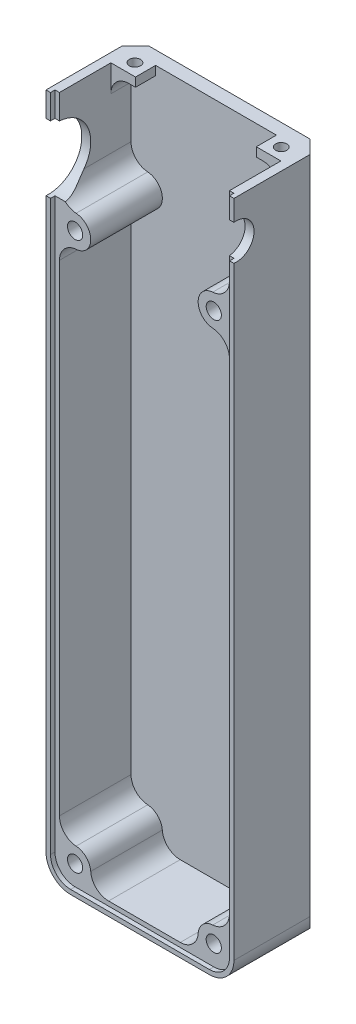
from build123d import *

# Parameters (mm, degrees)
SKETCH_1_W                  = 42
SKETCH_1_H                  = 153
EXTRUDE_1_DEPTH             = 20
SKETCH_2_W                  = 38
SKETCH_2_H                  = 149
CUT_EXTRUDE_1_DEPTH         = 17
EXTRUDE_3_DEPTH             = 17
FILLET_START                = 2
FILLET_2_DEPTH              = 18
CHAMFER_1_SIZE              = 3
CUT_EXTRUDE_3_DEPTH         = 82.812285141
SKETCH_8_R                  = 4
CUT_EXTRUDE_4_DEPTH         = 90.533513279
SKETCH_13_W                 = 27
SKETCH_13_H                 = 7.55790464
CUT_EXTRUDE_6_DEPTH         = 17
SKETCH_14_W                 = 38
SKETCH_14_H                 = 15.071373518
CUT_EXTRUDE_7_DEPTH         = 12.5
CUT_EXTRUDE_8_DEPTH         = 1
HOLE_WIZARD_M31_D           = 3.4
HOLE_WIZARD_M31_CBORE_D     = 6.5
HOLE_WIZARD_M31_CBORE_DEPTH = 3
M3X0_51_D                   = 2.5
M3X0_51_DEPTH               = 12.5
M3X0_51_TIP                 = 0.751075774
CUT_EXTRUDE_9_REACH         = 91.534
SKETCH_22_R                 = 7.5
CUT_EXTRUDE_10_REACH        = 91.534
SKETCH_23_R                 = 4


with BuildPart() as part:
    # Эскиз1 → Бобышка-Вытянуть1 (new body)
    with BuildSketch(Plane.XY):
        Rectangle(SKETCH_1_W, SKETCH_1_H)
    extrude(amount=EXTRUDE_1_DEPTH)

    # Эскиз2 → Вырез-Вытянуть1 (cut)
    with BuildSketch(Plane.XY.offset(20)):
        Rectangle(SKETCH_2_W, SKETCH_2_H)
    extrude(amount=-CUT_EXTRUDE_1_DEPTH, mode=Mode.SUBTRACT)

    # Эскиз3 → Бобышка-Вытянуть3 (add)
    with BuildSketch(Plane.XY.offset(20)):
        with BuildLine():
            Line((-19, -71), (-19, -74.5))
            Line((-19, -74.5), (-15.5, -74.5))
            ThreePointArc((-15.5, -74.5), (-13.025126266, -68.525126266), (-19, -71))
        make_face()
        with BuildLine():
            Line((19, -71), (19, -74.5))
            Line((19, -74.5), (15.5, -74.5))
            ThreePointArc((15.5, -74.5), (13.025126266, -68.525126266), (19, -71))
        make_face()
        with BuildLine():
            Line((-15.5, 55), (-19, 55))
            Line((-19, 55), (-19, 48))
            Line((-19, 48), (-15.5, 48))
            ThreePointArc((-15.5, 48), (-12, 51.5), (-15.5, 55))
        make_face()
        with BuildLine():
            Line((15.5, 55), (19, 55))
            Line((19, 55), (19, 48))
            Line((19, 48), (15.5, 48))
            ThreePointArc((15.5, 48), (12, 51.5), (15.5, 55))
        make_face()
    extrude(amount=-EXTRUDE_3_DEPTH)

    # Скругление2: read off the stored shape, not the designer's step
    # Скругление2 outline → Скругление2 (add)
    with BuildSketch(Plane.XY.offset(FILLET_START)):
        with BuildLine():
            ThreePointArc((19, 58.983314774), (17.921186974, 56.25079457), (15.266666667, 54.992213561))
            ThreePointArc((15.266666667, 54.992213561), (15.383268392, 54.998052849), (15.5, 55))
            Line((15.5, 55), (19, 55))
            Line((19, 55), (19, 58.983314774))
        make_face()
        with BuildLine():
            ThreePointArc((15.5, 48), (15.383268392, 48.001947151), (15.266666667, 48.007786439))
            ThreePointArc((15.266666667, 48.007786439), (17.921186974, 46.74920543), (19, 44.016685226))
            Line((19, 44.016685226), (19, 48))
            Line((19, 48), (15.5, 48))
        make_face()
        with BuildLine():
            ThreePointArc((15, 74.5), (17.828427125, 73.328427125), (19, 70.5))
            Line((19, 70.5), (19, 74.5))
            Line((19, 74.5), (15, 74.5))
        make_face()
        with BuildLine():
            Line((19, -71), (19, -63.516685226))
            ThreePointArc((19, -63.516685226), (17.921186974, -66.24920543), (15.266666667, -67.507786439))
            ThreePointArc((15.266666667, -67.507786439), (17.890955179, -68.443961399), (19, -71))
        make_face()
        with BuildLine():
            ThreePointArc((-19, 70.5), (-17.828427125, 73.328427125), (-15, 74.5))
            Line((-15, 74.5), (-19, 74.5))
            Line((-19, 74.5), (-19, 70.5))
        make_face()
        with BuildLine():
            ThreePointArc((15.5, -74.5), (12.943961399, -73.390955179), (12.007786439, -70.766666667))
            ThreePointArc((12.007786439, -70.766666667), (10.74920543, -73.421186974), (8.016685226, -74.5))
            Line((8.016685226, -74.5), (15.5, -74.5))
        make_face()
        with BuildLine():
            ThreePointArc((-15.266666667, 54.992213561), (-17.921186974, 56.25079457), (-19, 58.983314774))
            Line((-19, 58.983314774), (-19, 55))
            Line((-19, 55), (-15.5, 55))
            ThreePointArc((-15.5, 55), (-15.383268392, 54.998052849), (-15.266666667, 54.992213561))
        make_face()
        with BuildLine():
            Line((-15.5, -74.5), (-8.016685226, -74.5))
            ThreePointArc((-8.016685226, -74.5), (-10.74920543, -73.421186974), (-12.007786439, -70.766666667))
            ThreePointArc((-12.007786439, -70.766666667), (-12.943961399, -73.390955179), (-15.5, -74.5))
        make_face()
        with BuildLine():
            ThreePointArc((-19, 44.016685226), (-17.921186974, 46.74920543), (-15.266666667, 48.007786439))
            ThreePointArc((-15.266666667, 48.007786439), (-15.383268392, 48.001947151), (-15.5, 48))
            Line((-15.5, 48), (-19, 48))
            Line((-19, 48), (-19, 44.016685226))
        make_face()
        with BuildLine():
            ThreePointArc((-19, -71), (-17.890955179, -68.443961399), (-15.266666667, -67.507786439))
            ThreePointArc((-15.266666667, -67.507786439), (-17.921186974, -66.24920543), (-19, -63.516685226))
            Line((-19, -63.516685226), (-19, -71))
        make_face()
    extrude(amount=FILLET_2_DEPTH)

    # Фаска1
    chamfer_1_edges = [part.edges().sort_by_distance(p)[0] for p in [
        (-21, 0, 0),
        (21, 0, 0),
    ]]
    chamfer(chamfer_1_edges, length=CHAMFER_1_SIZE)

    # Эскиз7 → Вырез-Вытянуть3 (cut, through all)
    with BuildSketch(Plane.XY.offset(20)):
        with BuildLine():
            Line((-21, -71), (-21, -76.5))
            Line((-21, -76.5), (-15.5, -76.5))
            ThreePointArc((-15.5, -76.5), (-19.389087297, -74.889087297), (-21, -71))
        make_face()
        with BuildLine():
            Line((21, -76.5), (15.5, -76.5))
            ThreePointArc((15.5, -76.5), (19.389087297, -74.889087297), (21, -71))
            Line((21, -71), (21, -76.5))
        make_face()
    extrude(amount=-CUT_EXTRUDE_3_DEPTH, mode=Mode.SUBTRACT)

    # Эскиз8 → Вырез-Вытянуть4 (cut, through all)
    with BuildSketch(Plane.ZY.offset(21)):
        with Locations((-3, -58.5)):
            Circle(SKETCH_8_R)
        with Locations((-3, -38.5)):
            Circle(SKETCH_8_R)
        with Locations((-3, -18.5)):
            Circle(SKETCH_8_R)
        with Locations((-3, 1.5)):
            Circle(SKETCH_8_R)
        with Locations((-3, 21.5)):
            Circle(SKETCH_8_R)
        with Locations((-3, 41.5)):
            Circle(SKETCH_8_R)
        with Locations((-3, 61.5)):
            Circle(SKETCH_8_R)
    extrude(amount=-CUT_EXTRUDE_4_DEPTH, mode=Mode.SUBTRACT)

    # Эскиз13 → Вырез-Вытянуть6 (cut)
    with BuildSketch(Plane.XY.offset(20)):
        with Locations((0, 74.5)):
            Rectangle(SKETCH_13_W, SKETCH_13_H)
    extrude(amount=-CUT_EXTRUDE_6_DEPTH, mode=Mode.SUBTRACT)

    # Эскиз14 → Вырез-Вытянуть7 (cut)
    with BuildSketch(Plane.XY.offset(20)):
        with Locations((0, 76.5)):
            Rectangle(SKETCH_14_W, SKETCH_14_H)
    extrude(amount=-CUT_EXTRUDE_7_DEPTH, mode=Mode.SUBTRACT)

    # Эскиз15 → Вырез-Вытянуть8 (cut)
    with BuildSketch(Plane.XY.offset(20)):
        with BuildLine():
            Line((-20, 76.5), (20, 76.5))
            Line((20, 76.5), (20, -71))
            ThreePointArc((20, -71), (18.681980515, -74.181980515), (15.5, -75.5))
            Line((15.5, -75.5), (-15.5, -75.5))
            ThreePointArc((-15.5, -75.5), (-18.681980515, -74.181980515), (-20, -71))
            Line((-20, -71), (-20, 76.5))
        make_face()
    extrude(amount=-CUT_EXTRUDE_8_DEPTH, mode=Mode.SUBTRACT)

    # Цековка для винта с внутренним шестигранником M31 (through all)
    with Locations(Plane(origin=(0, 0, 0), x_dir=(-1, 0, 0), z_dir=(0, 0, -1))):
        with Locations((-15.5, 51.5), (15.5, 51.5), (15.5, -71), (-15.5, -71)):
            CounterBoreHole(HOLE_WIZARD_M31_D / 2, HOLE_WIZARD_M31_CBORE_D / 2, HOLE_WIZARD_M31_CBORE_DEPTH)

    # Отверстие обработанное метчиком M3x0.51
    with Locations(Plane(origin=(0, 76.5, 0), x_dir=(1, 0, 0), z_dir=(0, 1, 0))):
        with Locations((-16.349186161, -4.77912666), (16.349186161, -4.77912666)):
            Hole(M3X0_51_D / 2, depth=M3X0_51_DEPTH)
            with Locations((0, 0, -(M3X0_51_DEPTH + M3X0_51_TIP / 2))):  # 118° drill point
                Cone(0, M3X0_51_D / 2, M3X0_51_TIP, mode=Mode.SUBTRACT)

    # Эскиз22 → Вырез-Вытянуть9 (cut, up to next)
    with BuildSketch(Plane.ZY.offset(21), mode=Mode.PRIVATE) as cut_extrude_9_sk1:
        with Locations((19.5, 63.5)):
            Circle(SKETCH_22_R)
    cut_extrude_9_tool1 = extrude(cut_extrude_9_sk1.sketch, amount=-CUT_EXTRUDE_9_REACH, mode=Mode.PRIVATE) & part.part
    add(cut_extrude_9_tool1.solids().sort_by_distance((-21, 63.5, 19.5))[0], mode=Mode.SUBTRACT)

    # Эскиз23 → Вырез-Вытянуть10 (cut, up to next)
    with BuildSketch(Plane(origin=(21, 0, 0), x_dir=(0, 0, -1), z_dir=(1, 0, 0)), mode=Mode.PRIVATE) as cut_extrude_10_sk1:
        with Locations((-19.5, 67.89)):
            Circle(SKETCH_23_R)
    cut_extrude_10_tool1 = extrude(cut_extrude_10_sk1.sketch, amount=-CUT_EXTRUDE_10_REACH, mode=Mode.PRIVATE) & part.part
    add(cut_extrude_10_tool1.solids().sort_by_distance((21, 67.89, 19.5))[0], mode=Mode.SUBTRACT)


solid = part.part
